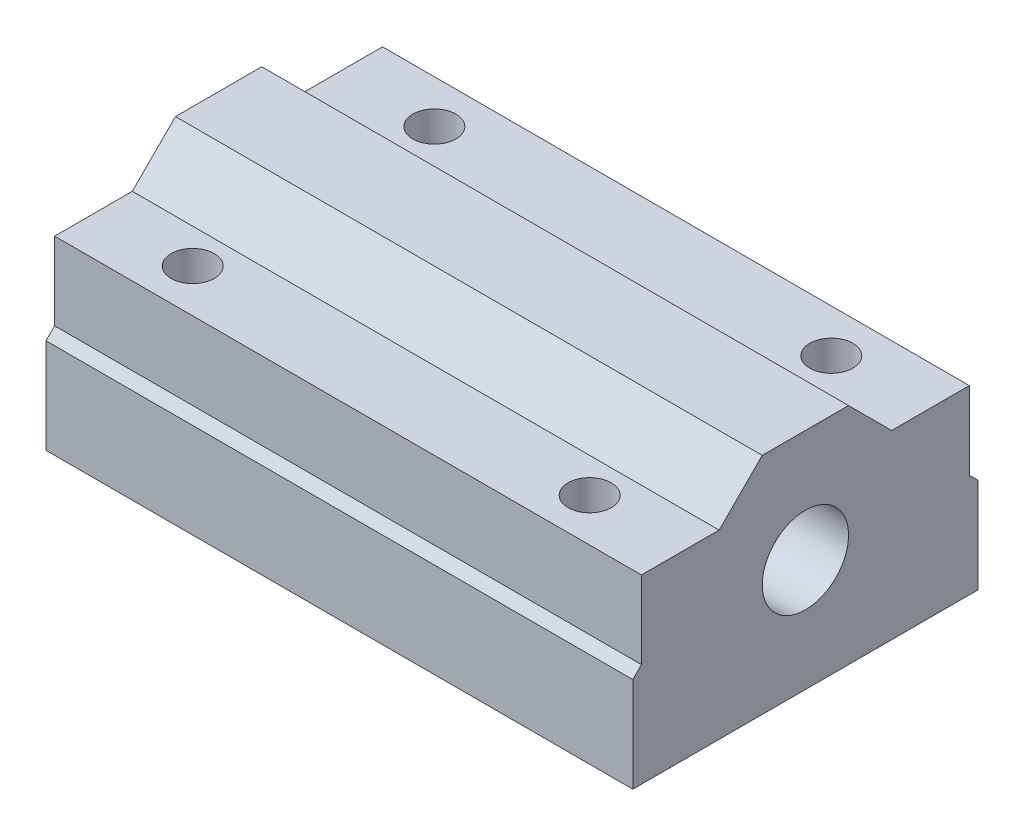
from build123d import *

# Parameters (mm, degrees)
SKETCH_1_W          = 68
SKETCH_1_H          = 40
SKETCH_1_R          = 2.5
EXTRUDE_1_DEPTH     = 26
SKETCH_2_R          = 5
CUT_EXTRUDE_1_DEPTH = 76
SKETCH_3_W          = 68
SKETCH_3_H          = 10
CUT_EXTRUDE_2_DEPTH = 5
CHAMFER_1_SIZE      = 5
CHAMFER_2_SIZE      = 5
SKETCH_4_W          = 68
SKETCH_4_H          = 1
CUT_EXTRUDE_3_DEPTH = 9
CHAMFER_3_SIZE      = 1
CHAMFER_4_SIZE      = 1


with BuildPart() as part:
    # Эскиз1 → Бобышка-Вытянуть1 (new body)
    with BuildSketch(Plane(origin=(0, 0, 0), x_dir=(1, 0, 0), z_dir=(0, 1, 0))):
        with Locations((34, 20)):
            Rectangle(SKETCH_1_W, SKETCH_1_H)
        with Locations(Location((11, 34, 0), (0, 0, 90))):
            Circle(SKETCH_1_R, mode=Mode.SUBTRACT)
        with Locations(Location((11, 6, 0), (0, 0, 90))):
            Circle(SKETCH_1_R, mode=Mode.SUBTRACT)
        with Locations(Location((57, 34, 0), (0, 0, 90))):
            Circle(SKETCH_1_R, mode=Mode.SUBTRACT)
        with Locations(Location((57, 6, 0), (0, 0, 90))):
            Circle(SKETCH_1_R, mode=Mode.SUBTRACT)
    extrude(amount=EXTRUDE_1_DEPTH)

    # Эскиз2 → Вырез-Вытянуть1 (cut)
    with BuildSketch(Plane.ZY):
        with Locations((-20, 13)):
            Circle(SKETCH_2_R)
    extrude(amount=-CUT_EXTRUDE_1_DEPTH, mode=Mode.SUBTRACT)

    # Эскиз3 → Вырез-Вытянуть2 (cut)
    with BuildSketch(Plane(origin=(0, 26, 0), x_dir=(1, 0, 0), z_dir=(0, 1, 0))):
        with Locations((34, 35)):
            Rectangle(SKETCH_3_W, SKETCH_3_H)
        with Locations((34, 5)):
            Rectangle(SKETCH_3_W, SKETCH_3_H)
    extrude(amount=-CUT_EXTRUDE_2_DEPTH, mode=Mode.SUBTRACT)

    # Фаска1
    chamfer_1_edges = [part.edges().sort_by_distance(p)[0] for p in [
        (34, 26, -30),
    ]]
    chamfer(chamfer_1_edges, length=CHAMFER_1_SIZE - 0.0001)  # a hair under: the kernel refuses the full size

    # Фаска2
    chamfer_2_edges = [part.edges().sort_by_distance(p)[0] for p in [
        (34, 26, -10),
    ]]
    chamfer(chamfer_2_edges, length=CHAMFER_2_SIZE - 0.0001)  # a hair under: the kernel refuses the full size

    # Эскиз4 → Вырез-Вытянуть3 (cut)
    with BuildSketch(Plane(origin=(0, 21, 0), x_dir=(1, 0, 0), z_dir=(0, 1, 0))):
        with Locations((34, 39.5)):
            Rectangle(SKETCH_4_W, SKETCH_4_H)
        with Locations((34, 0.5)):
            Rectangle(SKETCH_4_W, SKETCH_4_H)
    extrude(amount=-CUT_EXTRUDE_3_DEPTH, mode=Mode.SUBTRACT)

    # Фаска3
    chamfer_3_edges = [part.edges().sort_by_distance(p)[0] for p in [
        (34, 12, -40),
    ]]
    chamfer(chamfer_3_edges, length=CHAMFER_3_SIZE - 0.0001)  # a hair under: the kernel refuses the full size

    # Фаска4
    chamfer_4_edges = [part.edges().sort_by_distance(p)[0] for p in [
        (34, 12, 0),
    ]]
    chamfer(chamfer_4_edges, length=CHAMFER_4_SIZE - 0.0001)  # a hair under: the kernel refuses the full size


solid = part.part
